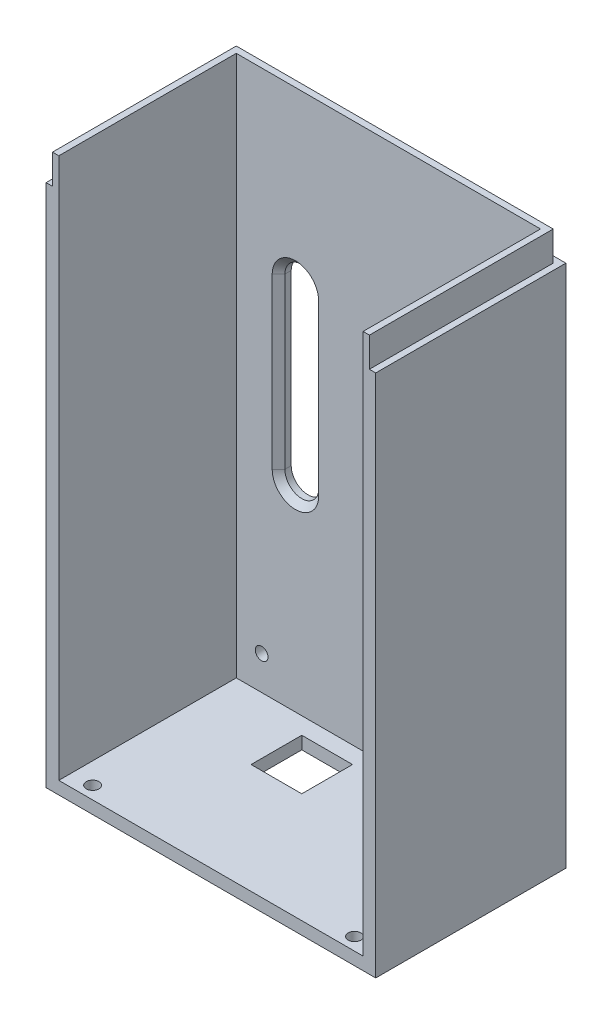
from build123d import *

# Parameters (mm, degrees)
SKETCH2_W           = 78
SKETCH2_H           = 256
BOSS_EXTRUDE1_DEPTH = 3
SKETCH3_W           = 78
SKETCH3_H           = 256
SKETCH3_W_2         = 72
SKETCH3_H_2         = 250
BOSS_EXTRUDE2_DEPTH = 42
SKETCH4_W           = 12
SKETCH4_H           = 12
SKETCH4_W_2         = 9.5
SKETCH4_H_2         = 11
CUT_EXTRUDE3_DEPTH  = 7
SKETCH6_W           = 11
SKETCH6_H           = 15
CUT_EXTRUDE4_DEPTH  = 6
SKETCH9_R           = 1.5
CUT_EXTRUDE6_DEPTH  = 263.834548718
CUT_EXTRUDE8_DEPTH  = 142.173651933
SKETCH16_R          = 1.5
CUT_EXTRUDE9_DEPTH  = 142.173651933
SKETCH19_W          = 37
SKETCH19_H          = 28
CUT_EXTRUDE11_DEPTH = 15
SKETCH25_W          = 7
SKETCH25_H          = 20
CUT_EXTRUDE16_DEPTH = 4
SKETCH27_R          = 1.5
CUT_EXTRUDE17_DEPTH = 10
CUT_EXTRUDE18_DEPTH = 141.24621207
SKETCH30_W          = 78
SKETCH30_H          = 125
CUT_EXTRUDE19_DEPTH = 141.24621207
SKETCH31_W          = 1.5
SKETCH31_H          = 7
CUT_EXTRUDE20_DEPTH = 141.24621207
CUT_EXTRUDE24_DEPTH = 7
CHAMFER1_SIZE       = 1.5
CHAMFER2_SIZE       = 1.5


with BuildPart() as part:
    # Sketch2 → Boss-Extrude1 (new body)
    with BuildSketch(Plane.XY):
        Rectangle(SKETCH2_W, SKETCH2_H)
    extrude(amount=BOSS_EXTRUDE1_DEPTH)

    # Sketch3 → Boss-Extrude2 (add)
    with BuildSketch(Plane.XY.offset(3)):
        Rectangle(SKETCH3_W, SKETCH3_H)
        Rectangle(SKETCH3_W_2, SKETCH3_H_2, mode=Mode.SUBTRACT)
    extrude(amount=BOSS_EXTRUDE2_DEPTH)

    # Sketch4 → Cut-Extrude3 (cut)
    with BuildSketch(Plane.XZ.offset(128)):
        with Locations((-10.5, 13)):
            Rectangle(SKETCH4_W, SKETCH4_H)
        with Locations((19.25, 12.5)):
            Rectangle(SKETCH4_W_2, SKETCH4_H_2)
    extrude(amount=-CUT_EXTRUDE3_DEPTH, mode=Mode.SUBTRACT)

    # Sketch6 → Cut-Extrude4 (cut)
    with BuildSketch(Plane.ZY.offset(39)):
        with Locations((11.5, 60.5)):
            Rectangle(SKETCH6_W, SKETCH6_H)
    extrude(amount=-CUT_EXTRUDE4_DEPTH, mode=Mode.SUBTRACT)

    # Sketch9 → Cut-Extrude6 (cut, through all)
    with BuildSketch(Plane.XZ.offset(128)):
        with Locations((-31, 42)):
            Circle(SKETCH9_R)
        with Locations((31, 42)):
            Circle(SKETCH9_R)
    extrude(amount=-CUT_EXTRUDE6_DEPTH, mode=Mode.SUBTRACT)

    # Sketch14 → Cut-Extrude8 (cut, through all)
    with BuildSketch(Plane(origin=(0, 0, 0), x_dir=(-1, 0, 0), z_dir=(0, 0, -1))):
        with BuildLine():
            Line((26, 99.112167767), (26, 59.112167767))
            ThreePointArc((26, 59.112167767), (22, 55.112167767), (18, 59.112167767))
            Line((18, 59.112167767), (18, 99.112167767))
            ThreePointArc((18, 99.112167767), (22, 103.112167767), (26, 99.112167767))
        make_face()
        with BuildLine():
            Line((-18, 99.112167767), (-18, 59.112167767))
            ThreePointArc((-18, 59.112167767), (-22, 55.112167767), (-26, 59.112167767))
            Line((-26, 59.112167767), (-26, 99.112167767))
            ThreePointArc((-26, 99.112167767), (-22, 103.112167767), (-18, 99.112167767))
        make_face()
        with BuildLine():
            Line((26, -38), (26, -78))
            ThreePointArc((26, -78), (22, -82), (18, -78))
            Line((18, -78), (18, -38))
            ThreePointArc((18, -38), (22, -34), (26, -38))
        make_face()
        with BuildLine():
            Line((-18, -38), (-18, -78))
            ThreePointArc((-18, -78), (-22, -82), (-26, -78))
            Line((-26, -78), (-26, -38))
            ThreePointArc((-26, -38), (-22, -34), (-18, -38))
        make_face()
    extrude(amount=-CUT_EXTRUDE8_DEPTH, mode=Mode.SUBTRACT)

    # Sketch16 → Cut-Extrude9 (cut, through all)
    with BuildSketch(Plane(origin=(0, 0, 0), x_dir=(-1, 0, 0), z_dir=(0, 0, -1))):
        with Locations((30, 117)):
            Circle(SKETCH16_R)
        with Locations((-30, 117)):
            Circle(SKETCH16_R)
        with Locations((30, -117)):
            Circle(SKETCH16_R)
        with Locations((-30, -117)):
            Circle(SKETCH16_R)
    extrude(amount=-CUT_EXTRUDE9_DEPTH, mode=Mode.SUBTRACT)

    # Sketch19 → Cut-Extrude11 (cut)
    with BuildSketch(Plane(origin=(0, 128, 0), x_dir=(1, 0, 0), z_dir=(0, 1, 0))):
        with Locations((0.5, -21)):
            Rectangle(SKETCH19_W, SKETCH19_H)
    extrude(amount=-CUT_EXTRUDE11_DEPTH, mode=Mode.SUBTRACT)

    # Sketch25 → Cut-Extrude16 (cut)
    with BuildSketch(Plane(origin=(0, 128, 0), x_dir=(1, 0, 0), z_dir=(0, 1, 0))):
        with Locations((-31.5, -25)):
            Rectangle(SKETCH25_W, SKETCH25_H)
        with Locations((31.5, -25)):
            Rectangle(SKETCH25_W, SKETCH25_H)
    extrude(amount=-CUT_EXTRUDE16_DEPTH, mode=Mode.SUBTRACT)

    # Sketch27 → Cut-Extrude17 (cut)
    with BuildSketch(Plane(origin=(0, 128, 0), x_dir=(1, 0, 0), z_dir=(0, 1, 0))):
        with Locations((-21.504408728, -8)):
            Circle(SKETCH27_R)
        with Locations((24.504408728, -8)):
            Circle(SKETCH27_R)
        with Locations((-21.504408728, -35)):
            Circle(SKETCH27_R)
        with Locations((24.504408728, -35)):
            Circle(SKETCH27_R)
    extrude(amount=-CUT_EXTRUDE17_DEPTH, mode=Mode.SUBTRACT)

    # Sketch29 → Cut-Extrude18 (cut, through all)
    with BuildSketch(Plane.XY.offset(3)):
        Polygon((-39, 128), (39, 128), (39, 3), (36, 3), (-39, 3), align=None)
    extrude(amount=CUT_EXTRUDE18_DEPTH, mode=Mode.SUBTRACT)

    # Sketch30 → Cut-Extrude19 (cut, through all)
    with BuildSketch(Plane.XY.offset(3)):
        with Locations((0, 65.5)):
            Rectangle(SKETCH30_W, SKETCH30_H)
    extrude(amount=-CUT_EXTRUDE19_DEPTH, mode=Mode.SUBTRACT)

    # Sketch31 → Cut-Extrude20 (cut, through all)
    with BuildSketch(Plane.XY.offset(3)):
        with Locations((-38.25, -0.5)):
            Rectangle(SKETCH31_W, SKETCH31_H)
        with Locations((38.25, -0.5)):
            Rectangle(SKETCH31_W, SKETCH31_H)
    extrude(amount=CUT_EXTRUDE20_DEPTH, mode=Mode.SUBTRACT)

    # Sketch34 → Cut-Extrude24 (cut)
    with BuildSketch(Plane(origin=(0, 3, 0), x_dir=(1, 0, 0), z_dir=(0, 1, 0))):
        Polygon((39, 0), (-39, 0), (-39, -1.5), (-39, -3), (-37.5, -3), (-37.5, -1.5), (37.5, -1.5), (37.5, -3), (39, -3), (39, -1.5), align=None)
    extrude(amount=-CUT_EXTRUDE24_DEPTH, mode=Mode.SUBTRACT)

    # Chamfer1
    chamfer1_edges = [part.edges().sort_by_distance(p)[0] for p in [
        (-26, -58, 3),
        (-22, -82, 3),
        (-22, -34, 3),
        (-18, -58, 3),
    ]]
    chamfer(chamfer1_edges, length=CHAMFER1_SIZE)

    # Chamfer2
    chamfer2_edges = [part.edges().sort_by_distance(p)[0] for p in [
        (26, -58, 0),
        (22, -82, 0),
        (22, -34, 0),
        (18, -58, 0),
    ]]
    chamfer(chamfer2_edges, length=CHAMFER2_SIZE)


solid = part.part
